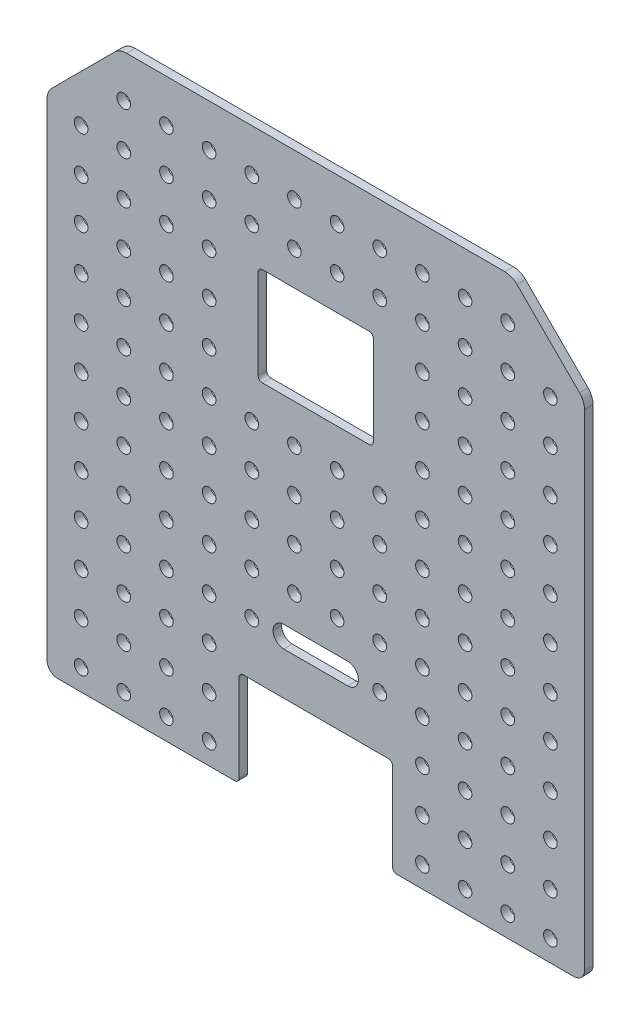
from build123d import *

# Parameters (mm, degrees)
SKETCH_1_W              = 126
SKETCH_1_H              = 135
EXTRUDE_439_DEPTH       = 2
SKETCH_3_W              = 27
SKETCH_3_H              = 23
CUT_EXTRUDE_773_DEPTH   = 149.989932546
SKETCH_4_W              = 36
SKETCH_4_H              = 22.5
CUT_EXTRUDE_1029_DEPTH  = 149.989932546
CHAMFER_1_SIZE          = 17
CHAMFER_2_SIZE          = 17
SKETCH_2_R              = 1.6
CUT_EXTRUDE_10_10_DEPTH = 149.989932546
FILLET_1_R              = 1
FILLET_3_R              = 2.5
FILLET_2_R              = 4
SKETCH_5_W              = 20
SKETCH_5_H              = 5
CUT_EXTRUDE_4565_DEPTH  = 149.989932546
FILLET_4_R              = 2.5


with BuildPart() as part:
    # Эскиз1 → Extrude 439 (new body)
    with BuildSketch(Plane.XY):
        with Locations((0, -67.5)):
            Rectangle(SKETCH_1_W, SKETCH_1_H)
    extrude(amount=EXTRUDE_439_DEPTH)

    # Эскиз3 → Cut-Extrude 773 (cut, through all)
    with BuildSketch(Plane(origin=(0, 0, 0), x_dir=(-1, 0, 0), z_dir=(0, 0, -1))):
        with Locations((0, -39.5)):
            Rectangle(SKETCH_3_W, SKETCH_3_H)
    extrude(amount=-CUT_EXTRUDE_773_DEPTH, mode=Mode.SUBTRACT)

    # Эскиз4 → Cut-Extrude 1029 (cut, through all)
    with BuildSketch(Plane(origin=(0, 0, 0), x_dir=(-1, 0, 0), z_dir=(0, 0, -1))):
        with Locations((0, -123.75)):
            Rectangle(SKETCH_4_W, SKETCH_4_H)
    extrude(amount=-CUT_EXTRUDE_1029_DEPTH, mode=Mode.SUBTRACT)

    # Фаска1
    chamfer_1_edges = [part.edges().sort_by_distance(p)[0] for p in [
        (-63, 0, 1),
    ]]
    chamfer(chamfer_1_edges, length=CHAMFER_1_SIZE)

    # Фаска2
    chamfer_2_edges = [part.edges().sort_by_distance(p)[0] for p in [
        (63, 0, 1),
    ]]
    chamfer(chamfer_2_edges, length=CHAMFER_2_SIZE)

    # Эскиз2 → Сетка отв 10х10мм (cut, through all)
    with BuildSketch(Plane(origin=(0, 0, 0), x_dir=(-1, 0, 0), z_dir=(0, 0, -1))):
        with Locations((25, -130)):
            Circle(SKETCH_2_R)
        with Locations((35, -130)):
            Circle(SKETCH_2_R)
        with Locations((45, -130)):
            Circle(SKETCH_2_R)
        with Locations((55, -130)):
            Circle(SKETCH_2_R)
        with Locations((65, -130)):
            Circle(SKETCH_2_R)
        with Locations((-65, -130)):
            Circle(SKETCH_2_R)
        with Locations(Location((-55, -130, 0), (0, 0, 180))):
            Circle(SKETCH_2_R)
        with Locations(Location((-45, -130, 0), (0, 0, 180))):
            Circle(SKETCH_2_R)
        with Locations(Location((-35, -130, 0), (0, 0, 180))):
            Circle(SKETCH_2_R)
        with Locations(Location((-25, -130, 0), (0, 0, 180))):
            Circle(SKETCH_2_R)
        with Locations((25, -120)):
            Circle(SKETCH_2_R)
        with Locations((35, -120)):
            Circle(SKETCH_2_R)
        with Locations((45, -120)):
            Circle(SKETCH_2_R)
        with Locations((55, -120)):
            Circle(SKETCH_2_R)
        with Locations((65, -120)):
            Circle(SKETCH_2_R)
        with Locations((-65, -120)):
            Circle(SKETCH_2_R)
        with Locations(Location((-55, -120, 0), (0, 0, 180))):
            Circle(SKETCH_2_R)
        with Locations(Location((-45, -120, 0), (0, 0, 180))):
            Circle(SKETCH_2_R)
        with Locations(Location((-35, -120, 0), (0, 0, 180))):
            Circle(SKETCH_2_R)
        with Locations(Location((-25, -120, 0), (0, 0, 180))):
            Circle(SKETCH_2_R)
        with Locations((25, -110)):
            Circle(SKETCH_2_R)
        with Locations((35, -110)):
            Circle(SKETCH_2_R)
        with Locations((45, -110)):
            Circle(SKETCH_2_R)
        with Locations((55, -110)):
            Circle(SKETCH_2_R)
        with Locations((65, -110)):
            Circle(SKETCH_2_R)
        with Locations((-65, -110)):
            Circle(SKETCH_2_R)
        with Locations(Location((-55, -110, 0), (0, 0, 180))):
            Circle(SKETCH_2_R)
        with Locations(Location((-45, -110, 0), (0, 0, 180))):
            Circle(SKETCH_2_R)
        with Locations(Location((-35, -110, 0), (0, 0, 180))):
            Circle(SKETCH_2_R)
        with Locations(Location((-25, -110, 0), (0, 0, 180))):
            Circle(SKETCH_2_R)
        with Locations((5, -100)):
            Circle(SKETCH_2_R)
        with Locations((15, -100)):
            Circle(SKETCH_2_R)
        with Locations((25, -100)):
            Circle(SKETCH_2_R)
        with Locations((35, -100)):
            Circle(SKETCH_2_R)
        with Locations((45, -100)):
            Circle(SKETCH_2_R)
        with Locations((55, -100)):
            Circle(SKETCH_2_R)
        with Locations((65, -100)):
            Circle(SKETCH_2_R)
        with Locations((-65, -100)):
            Circle(SKETCH_2_R)
        with Locations(Location((-55, -100, 0), (0, 0, 180))):
            Circle(SKETCH_2_R)
        with Locations(Location((-45, -100, 0), (0, 0, 180))):
            Circle(SKETCH_2_R)
        with Locations(Location((-35, -100, 0), (0, 0, 180))):
            Circle(SKETCH_2_R)
        with Locations(Location((-25, -100, 0), (0, 0, 180))):
            Circle(SKETCH_2_R)
        with Locations(Location((-15, -100, 0), (0, 0, 180))):
            Circle(SKETCH_2_R)
        with Locations(Location((-5, -100, 0), (0, 0, 180))):
            Circle(SKETCH_2_R)
        with Locations((5, -90)):
            Circle(SKETCH_2_R)
        with Locations((15, -90)):
            Circle(SKETCH_2_R)
        with Locations((25, -90)):
            Circle(SKETCH_2_R)
        with Locations((35, -90)):
            Circle(SKETCH_2_R)
        with Locations((45, -90)):
            Circle(SKETCH_2_R)
        with Locations((55, -90)):
            Circle(SKETCH_2_R)
        with Locations((65, -90)):
            Circle(SKETCH_2_R)
        with Locations((-65, -90)):
            Circle(SKETCH_2_R)
        with Locations(Location((-55, -90, 0), (0, 0, 180))):
            Circle(SKETCH_2_R)
        with Locations(Location((-45, -90, 0), (0, 0, 180))):
            Circle(SKETCH_2_R)
        with Locations(Location((-35, -90, 0), (0, 0, 180))):
            Circle(SKETCH_2_R)
        with Locations(Location((-25, -90, 0), (0, 0, 180))):
            Circle(SKETCH_2_R)
        with Locations(Location((-15, -90, 0), (0, 0, 180))):
            Circle(SKETCH_2_R)
        with Locations(Location((-5, -90, 0), (0, 0, 180))):
            Circle(SKETCH_2_R)
        with Locations((5, -80)):
            Circle(SKETCH_2_R)
        with Locations((15, -80)):
            Circle(SKETCH_2_R)
        with Locations((25, -80)):
            Circle(SKETCH_2_R)
        with Locations((35, -80)):
            Circle(SKETCH_2_R)
        with Locations((45, -80)):
            Circle(SKETCH_2_R)
        with Locations((55, -80)):
            Circle(SKETCH_2_R)
        with Locations((65, -80)):
            Circle(SKETCH_2_R)
        with Locations((-65, -80)):
            Circle(SKETCH_2_R)
        with Locations(Location((-55, -80, 0), (0, 0, 180))):
            Circle(SKETCH_2_R)
        with Locations(Location((-45, -80, 0), (0, 0, 180))):
            Circle(SKETCH_2_R)
        with Locations(Location((-35, -80, 0), (0, 0, 180))):
            Circle(SKETCH_2_R)
        with Locations(Location((-25, -80, 0), (0, 0, 180))):
            Circle(SKETCH_2_R)
        with Locations(Location((-15, -80, 0), (0, 0, 180))):
            Circle(SKETCH_2_R)
        with Locations(Location((-5, -80, 0), (0, 0, 180))):
            Circle(SKETCH_2_R)
        with Locations((5, -70)):
            Circle(SKETCH_2_R)
        with Locations((15, -70)):
            Circle(SKETCH_2_R)
        with Locations((25, -70)):
            Circle(SKETCH_2_R)
        with Locations((35, -70)):
            Circle(SKETCH_2_R)
        with Locations((45, -70)):
            Circle(SKETCH_2_R)
        with Locations((55, -70)):
            Circle(SKETCH_2_R)
        with Locations((65, -70)):
            Circle(SKETCH_2_R)
        with Locations((-65, -70)):
            Circle(SKETCH_2_R)
        with Locations(Location((-55, -70, 0), (0, 0, 180))):
            Circle(SKETCH_2_R)
        with Locations(Location((-45, -70, 0), (0, 0, 180))):
            Circle(SKETCH_2_R)
        with Locations(Location((-35, -70, 0), (0, 0, 180))):
            Circle(SKETCH_2_R)
        with Locations(Location((-25, -70, 0), (0, 0, 180))):
            Circle(SKETCH_2_R)
        with Locations(Location((-15, -70, 0), (0, 0, 180))):
            Circle(SKETCH_2_R)
        with Locations(Location((-5, -70, 0), (0, 0, 180))):
            Circle(SKETCH_2_R)
        with Locations((5, -60)):
            Circle(SKETCH_2_R)
        with Locations((15, -60)):
            Circle(SKETCH_2_R)
        with Locations((25, -60)):
            Circle(SKETCH_2_R)
        with Locations((35, -60)):
            Circle(SKETCH_2_R)
        with Locations((45, -60)):
            Circle(SKETCH_2_R)
        with Locations((55, -60)):
            Circle(SKETCH_2_R)
        with Locations((65, -60)):
            Circle(SKETCH_2_R)
        with Locations((-65, -60)):
            Circle(SKETCH_2_R)
        with Locations(Location((-55, -60, 0), (0, 0, 180))):
            Circle(SKETCH_2_R)
        with Locations(Location((-45, -60, 0), (0, 0, 180))):
            Circle(SKETCH_2_R)
        with Locations(Location((-35, -60, 0), (0, 0, 180))):
            Circle(SKETCH_2_R)
        with Locations(Location((-25, -60, 0), (0, 0, 180))):
            Circle(SKETCH_2_R)
        with Locations(Location((-15, -60, 0), (0, 0, 180))):
            Circle(SKETCH_2_R)
        with Locations(Location((-5, -60, 0), (0, 0, 180))):
            Circle(SKETCH_2_R)
        with Locations((25, -50)):
            Circle(SKETCH_2_R)
        with Locations((35, -50)):
            Circle(SKETCH_2_R)
        with Locations((45, -50)):
            Circle(SKETCH_2_R)
        with Locations((55, -50)):
            Circle(SKETCH_2_R)
        with Locations((65, -50)):
            Circle(SKETCH_2_R)
        with Locations((-65, -50)):
            Circle(SKETCH_2_R)
        with Locations(Location((-55, -50, 0), (0, 0, 180))):
            Circle(SKETCH_2_R)
        with Locations(Location((-45, -50, 0), (0, 0, 180))):
            Circle(SKETCH_2_R)
        with Locations(Location((-35, -50, 0), (0, 0, 180))):
            Circle(SKETCH_2_R)
        with Locations(Location((-25, -50, 0), (0, 0, 180))):
            Circle(SKETCH_2_R)
        with Locations((25, -40)):
            Circle(SKETCH_2_R)
        with Locations((35, -40)):
            Circle(SKETCH_2_R)
        with Locations((45, -40)):
            Circle(SKETCH_2_R)
        with Locations((55, -40)):
            Circle(SKETCH_2_R)
        with Locations((65, -40)):
            Circle(SKETCH_2_R)
        with Locations((-65, -40)):
            Circle(SKETCH_2_R)
        with Locations(Location((-55, -40, 0), (0, 0, 180))):
            Circle(SKETCH_2_R)
        with Locations(Location((-45, -40, 0), (0, 0, 180))):
            Circle(SKETCH_2_R)
        with Locations(Location((-35, -40, 0), (0, 0, 180))):
            Circle(SKETCH_2_R)
        with Locations(Location((-25, -40, 0), (0, 0, 180))):
            Circle(SKETCH_2_R)
        with Locations((25, -30)):
            Circle(SKETCH_2_R)
        with Locations((35, -30)):
            Circle(SKETCH_2_R)
        with Locations((45, -30)):
            Circle(SKETCH_2_R)
        with Locations((55, -30)):
            Circle(SKETCH_2_R)
        with Locations(Location((-55, -30, 0), (0, 0, 180))):
            Circle(SKETCH_2_R)
        with Locations(Location((-45, -30, 0), (0, 0, 180))):
            Circle(SKETCH_2_R)
        with Locations(Location((-35, -30, 0), (0, 0, 180))):
            Circle(SKETCH_2_R)
        with Locations(Location((-25, -30, 0), (0, 0, 180))):
            Circle(SKETCH_2_R)
        with Locations((5, -20)):
            Circle(SKETCH_2_R)
        with Locations((15, -20)):
            Circle(SKETCH_2_R)
        with Locations((25, -20)):
            Circle(SKETCH_2_R)
        with Locations((35, -20)):
            Circle(SKETCH_2_R)
        with Locations((45, -20)):
            Circle(SKETCH_2_R)
        with Locations((55, -20)):
            Circle(SKETCH_2_R)
        with Locations(Location((-55, -20, 0), (0, 0, 180))):
            Circle(SKETCH_2_R)
        with Locations(Location((-45, -20, 0), (0, 0, 180))):
            Circle(SKETCH_2_R)
        with Locations(Location((-35, -20, 0), (0, 0, 180))):
            Circle(SKETCH_2_R)
        with Locations(Location((-25, -20, 0), (0, 0, 180))):
            Circle(SKETCH_2_R)
        with Locations(Location((-15, -20, 0), (0, 0, 180))):
            Circle(SKETCH_2_R)
        with Locations(Location((-5, -20, 0), (0, 0, 180))):
            Circle(SKETCH_2_R)
        with Locations((5, -10)):
            Circle(SKETCH_2_R)
        with Locations((15, -10)):
            Circle(SKETCH_2_R)
        with Locations((25, -10)):
            Circle(SKETCH_2_R)
        with Locations((35, -10)):
            Circle(SKETCH_2_R)
        with Locations((45, -10)):
            Circle(SKETCH_2_R)
        with Locations(Location((-45, -10, 0), (0, 0, 180))):
            Circle(SKETCH_2_R)
        with Locations(Location((-35, -10, 0), (0, 0, 180))):
            Circle(SKETCH_2_R)
        with Locations(Location((-25, -10, 0), (0, 0, 180))):
            Circle(SKETCH_2_R)
        with Locations(Location((-15, -10, 0), (0, 0, 180))):
            Circle(SKETCH_2_R)
        with Locations(Location((-5, -10, 0), (0, 0, 180))):
            Circle(SKETCH_2_R)
    extrude(amount=-CUT_EXTRUDE_10_10_DEPTH, mode=Mode.SUBTRACT)

    # Скругление1
    fillet_1_edges = [part.edges().sort_by_distance(p)[0] for p in [
        (-13.5, -28, 1),
        (-13.5, -51, 1),
        (13.5, -51, 1),
        (13.5, -28, 1),
        (18, -135, 1),
        (18, -112.5, 1),
        (-18, -112.5, 1),
        (-18, -135, 1),
    ]]
    fillet(fillet_1_edges, radius=FILLET_1_R)

    # Скругление3
    fillet_3_edges = [part.edges().sort_by_distance(p)[0] for p in [
        (63, -135, 1),
        (-63, -135, 1),
    ]]
    fillet(fillet_3_edges, radius=FILLET_3_R)

    # Скругление2
    fillet_2_edges = [part.edges().sort_by_distance(p)[0] for p in [
        (-63, -17, 1),
        (-46, 0, 1),
        (46, 0, 1),
        (63, -17, 1),
    ]]
    fillet(fillet_2_edges, radius=FILLET_2_R)

    # Эскиз5 → Cut-Extrude 4565 (cut, through all)
    with BuildSketch(Plane.XY.offset(2)):
        with Locations((0, -100)):
            Rectangle(SKETCH_5_W, SKETCH_5_H)
    extrude(amount=-CUT_EXTRUDE_4565_DEPTH, mode=Mode.SUBTRACT)

    # Скругление4
    fillet_4_edges = [part.edges().sort_by_distance(p)[0] for p in [
        (10, -102.5, 1),
        (10, -97.5, 1),
        (-10, -102.5, 1),
        (-10, -97.5, 1),
    ]]
    fillet(fillet_4_edges, radius=FILLET_4_R - 0.0001)  # a hair under: the kernel refuses the full size


solid = part.part
